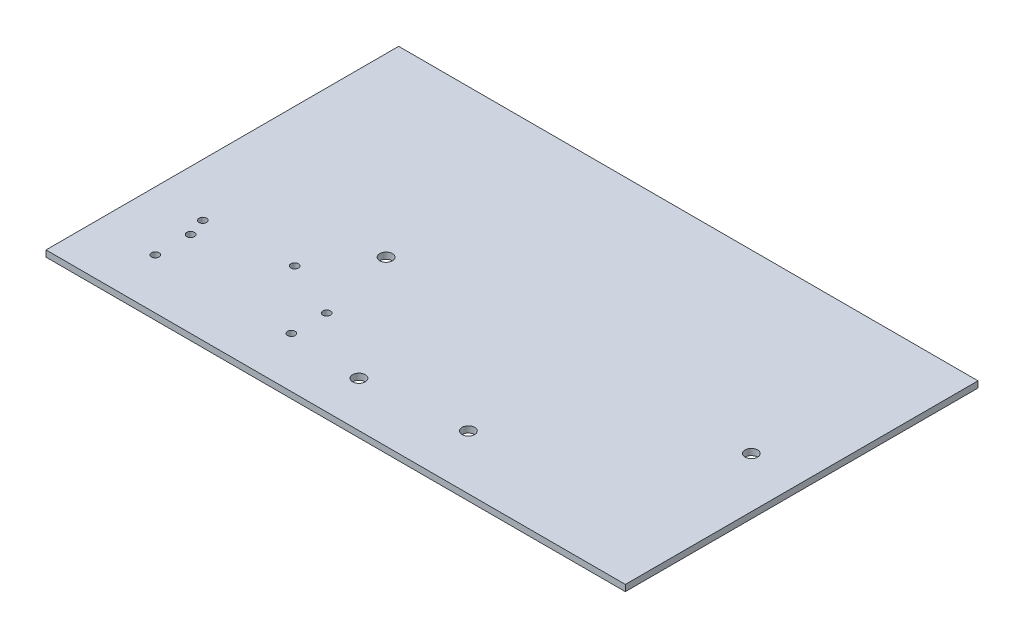
from build123d import *

# Parameters (mm, degrees)
SKETCH1_W           = 317.5
SKETCH1_H           = 177.8
SKETCH1_R           = 3.175
SKETCH1_R_2         = 1.905
BOSS_EXTRUDE1_DEPTH = 3.175
SKETCH2_R           = 1.905
CUT_EXTRUDE1_DEPTH  = 182.974869488
SKETCH3_R           = 3.175
CUT_EXTRUDE2_DEPTH  = 182.974869488
SKETCH4_W           = 25.4
SKETCH4_H           = 177.8
CUT_EXTRUDE3_DEPTH  = 182.974869488


with BuildPart() as part:
    # Sketch1 → Boss-Extrude1 (new body)
    with BuildSketch(Plane(origin=(0, 0, 0), x_dir=(1, 0, 0), z_dir=(0, 1, 0))):
        Rectangle(SKETCH1_W, SKETCH1_H)
        with Locations((-69.85, -6.35)):
            Circle(SKETCH1_R, mode=Mode.SUBTRACT)
        with Locations((107.95, 0)):
            Circle(SKETCH1_R, mode=Mode.SUBTRACT)
        with Locations((-129.032, -45.72)):
            Circle(SKETCH1_R_2, mode=Mode.SUBTRACT)
        with Locations((-60.452, -45.72)):
            Circle(SKETCH1_R_2, mode=Mode.SUBTRACT)
        with Locations((-129.032, -63.5)):
            Circle(SKETCH1_R_2, mode=Mode.SUBTRACT)
        with Locations((-60.452, -63.5)):
            Circle(SKETCH1_R_2, mode=Mode.SUBTRACT)
    extrude(amount=BOSS_EXTRUDE1_DEPTH)

    # Sketch2 → Cut-Extrude1 (cut, through all)
    with BuildSketch(Plane(origin=(0, 3.175, 0), x_dir=(1, 0, 0), z_dir=(0, 1, 0))):
        with Locations((-89.08170041, -33.177029855)):
            Circle(SKETCH2_R)
        with Locations((-132.137607944, -36.44830276)):
            Circle(SKETCH2_R)
    extrude(amount=-CUT_EXTRUDE1_DEPTH, mode=Mode.SUBTRACT)

    # Sketch3 → Cut-Extrude2 (cut, through all)
    with BuildSketch(Plane(origin=(0, 0, 0), x_dir=(-1, 0, 0), z_dir=(0, -1, 0))):
        with Locations((23.829539609, -66.04)):
            Circle(SKETCH3_R)
        with Locations((-26.764302072, -61.468)):
            Circle(SKETCH3_R)
    extrude(amount=-CUT_EXTRUDE2_DEPTH, mode=Mode.SUBTRACT)

    # Sketch4 → Cut-Extrude3 (cut, through all)
    with BuildSketch(Plane(origin=(0, 3.175, 0), x_dir=(1, 0, 0), z_dir=(0, 1, 0))):
        with Locations((146.05, 0)):
            Rectangle(SKETCH4_W, SKETCH4_H)
    extrude(amount=-CUT_EXTRUDE3_DEPTH, mode=Mode.SUBTRACT)


solid = part.part
